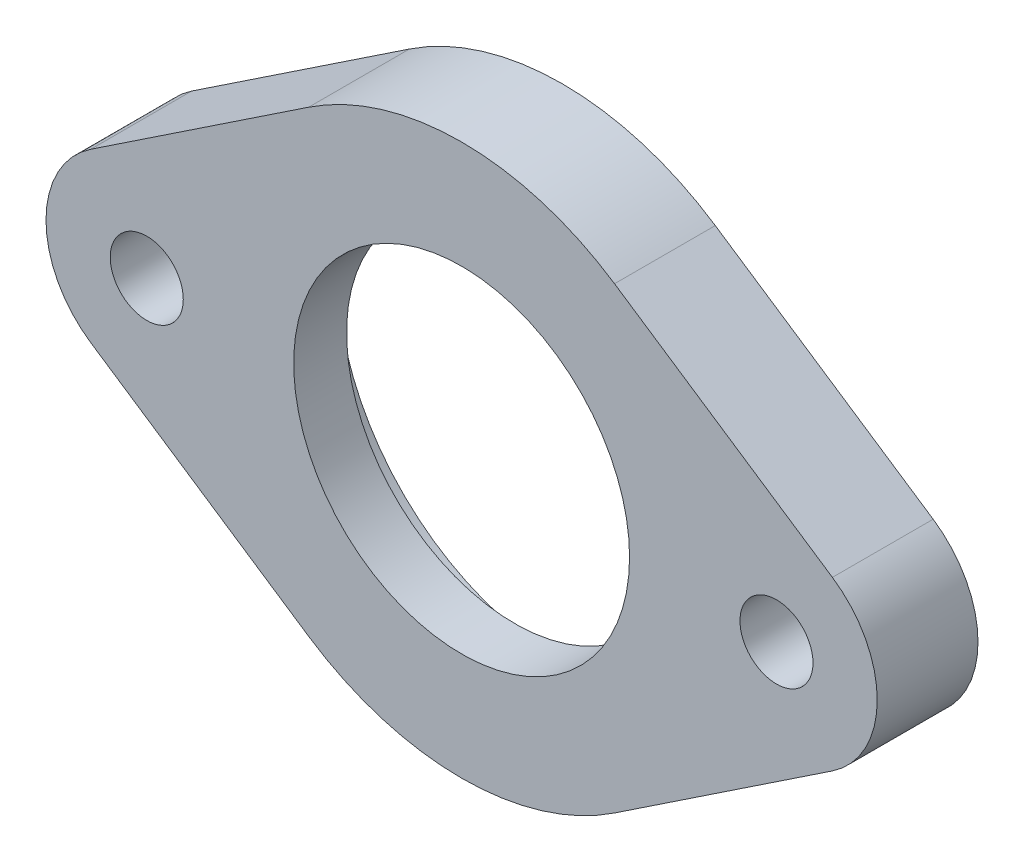
from build123d import *

# Parameters (mm, degrees)
BOSS_EXTRUDE1_DEPTH     = 4
CUT_EXTRUDE1_DEPTH      = 21.196012137
CUT_EXTRUDE1_DEPTH_BACK = 21.196012137
SKETCH1_4_R             = 6.6675
CUT_EXTRUDE2_DEPTH      = 1.9
CUT_EXTRUDE2_DEPTH_BACK = 21.196012137
SKETCH1_6_R             = 8.9375
M2_5_CLEARANCE_HOLE1_D  = 2.9


with BuildPart() as part:
    # Sketch1 → Boss-Extrude1 (new body)
    with BuildSketch(Plane.XY):
        with BuildLine():
            ThreePointArc((6.0703125, 9.098363172), (0, 10.9375), (-6.0703125, 9.098363172))
            Line((-6.0703125, 9.098363172), (-14.72, 3.327401388))
            ThreePointArc((-14.72, 3.327401388), (-16.5, 0), (-14.72, -3.327401388))
            Line((-14.72, -3.327401388), (-6.0703125, -9.098363172))
            ThreePointArc((-6.0703125, -9.098363172), (0, -10.9375), (6.0703125, -9.098363172))
            Line((6.0703125, -9.098363172), (14.72, -3.327401388))
            ThreePointArc((14.72, -3.327401388), (16.5, 0), (14.72, 3.327401388))
            Line((14.72, 3.327401388), (6.0703125, 9.098363172))
        make_face()
    extrude(amount=BOSS_EXTRUDE1_DEPTH)

    # Sketch1<4> → Cut-Extrude1 (cut, two sides: drawn at the far end of the back side and taken through both)
    with BuildSketch(Plane.XY.offset(-CUT_EXTRUDE1_DEPTH_BACK)):
        Circle(SKETCH1_4_R)
    extrude(amount=CUT_EXTRUDE1_DEPTH + CUT_EXTRUDE1_DEPTH_BACK, mode=Mode.SUBTRACT)

    # Sketch1<6> → Cut-Extrude2 (cut, two sides: drawn at the far end of the back side and taken through both)
    with BuildSketch(Plane.XY.offset(-CUT_EXTRUDE2_DEPTH_BACK)):
        Circle(SKETCH1_6_R)
    extrude(amount=CUT_EXTRUDE2_DEPTH + CUT_EXTRUDE2_DEPTH_BACK, mode=Mode.SUBTRACT)

    # M2.5 Clearance Hole1 (through all)
    with Locations(Plane.XY.offset(4)):
        with Locations((-12.5, 0), (12.5, 0)):
            Hole(M2_5_CLEARANCE_HOLE1_D / 2)


solid = part.part
